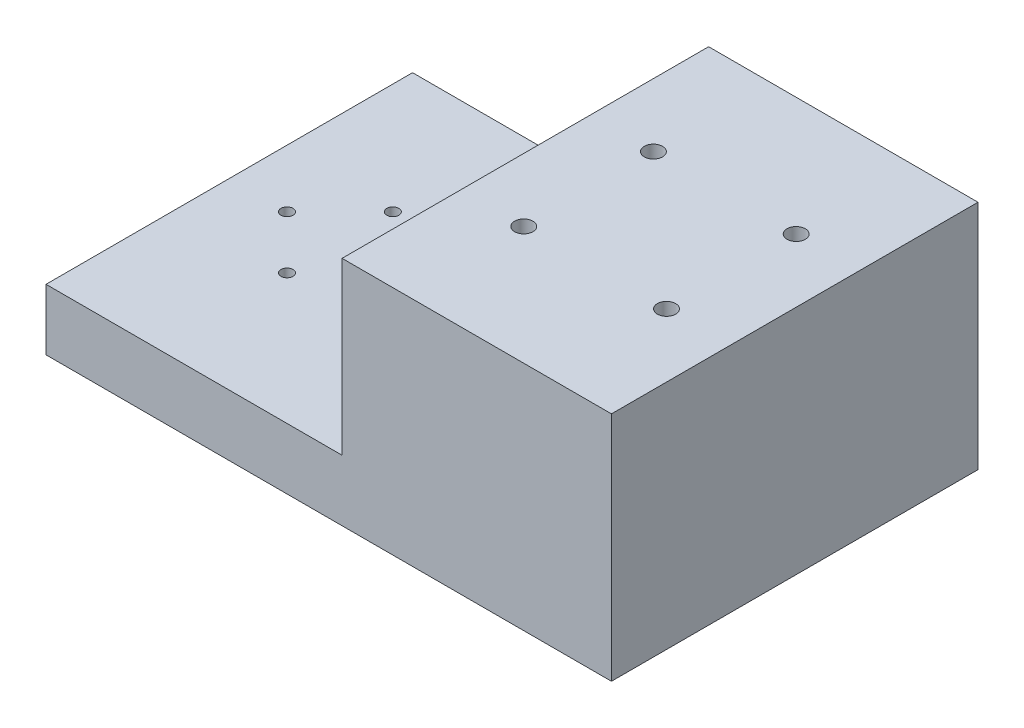
from build123d import *

# Parameters (mm, degrees)
SKETCH1_W                          = 76.2
SKETCH1_H                          = 12.7
BOSS_EXTRUDE1_DEPTH                = 117.55
F_2_5MM_DOWEL_HOLE2_D              = 2.5
SKETCH13_W                         = 56
SKETCH13_H                         = 76.2
BOSS_EXTRUDE3_DEPTH                = 35.45
SKETCH11_R                         = 3.75
CUT_EXTRUDE3_DEPTH                 = 24.5
SKETCH14_R                         = 1.905
CUT_EXTRUDE4_DEPTH                 = 126.975642487
TAP_DRILL_FOR_M2_5X0_45_TAP1_D     = 2.05
TAP_DRILL_FOR_M2_5X0_45_TAP1_DEPTH = 8.3
TAP_DRILL_FOR_M2_5X0_45_TAP1_TIP   = 0.615882135


with BuildPart() as part:
    # Sketch1 → Boss-Extrude1 (new body)
    with BuildSketch(Plane(origin=(0, 0, 0), x_dir=(0, 0, -1), z_dir=(1, 0, 0))):
        with Locations((0, 6.903854155)):
            Rectangle(SKETCH1_W, SKETCH1_H)
    extrude(amount=BOSS_EXTRUDE1_DEPTH)

    # Ø2.5mm Dowel Hole2 (through all)
    with Locations(Plane(origin=(0, 13.253854155, 0), x_dir=(1, 0, 0), z_dir=(0, 1, 0))):
        with Locations((12, 0), (34, 0), (23, -11), (23, 11)):
            Hole(F_2_5MM_DOWEL_HOLE2_D / 2)

    # Sketch13 → Boss-Extrude3 (add)
    with BuildSketch(Plane(origin=(0, 13.253854155, 0), x_dir=(1, 0, 0), z_dir=(0, 1, 0))):
        with Locations((89.55, 0)):
            Rectangle(SKETCH13_W, SKETCH13_H)
    extrude(amount=BOSS_EXTRUDE3_DEPTH)

    # Sketch11 → Cut-Extrude3 (cut)
    with BuildSketch(Plane(origin=(0, 0.553854155, 0), x_dir=(1, 0, 0), z_dir=(0, 1, 0))):
        with Locations((104.375, 13.4747)):
            Circle(SKETCH11_R)
        with Locations((74.695, 13.4747)):
            Circle(SKETCH11_R)
    cut_extrude3 = extrude(amount=CUT_EXTRUDE3_DEPTH, mode=Mode.SUBTRACT)

    # Sketch14 → Cut-Extrude4 (cut, through all)
    with BuildSketch(Plane.XZ.offset(-25.053854155)):
        with Locations((104.375, -13.4747)):
            Circle(SKETCH14_R)
        with Locations((74.695, -13.4747)):
            Circle(SKETCH14_R)
    cut_extrude4 = extrude(amount=-CUT_EXTRUDE4_DEPTH, mode=Mode.SUBTRACT)

    # Mirror2: Cut-Extrude3, Cut-Extrude4 across plane
    add(cut_extrude3.mirror(Plane.XY), mode=Mode.SUBTRACT)
    add(cut_extrude4.mirror(Plane.XY), mode=Mode.SUBTRACT)

    # Tap Drill for M2.5x0.45 Tap1
    with Locations(Plane.ZY):
        with Locations((-12.7, 6.903854155), (12.7, 6.903854155)):
            Hole(TAP_DRILL_FOR_M2_5X0_45_TAP1_D / 2, depth=TAP_DRILL_FOR_M2_5X0_45_TAP1_DEPTH)
            with Locations((0, 0, -(TAP_DRILL_FOR_M2_5X0_45_TAP1_DEPTH + TAP_DRILL_FOR_M2_5X0_45_TAP1_TIP / 2))):  # 118° drill point
                Cone(0, TAP_DRILL_FOR_M2_5X0_45_TAP1_D / 2, TAP_DRILL_FOR_M2_5X0_45_TAP1_TIP, mode=Mode.SUBTRACT)


solid = part.part
